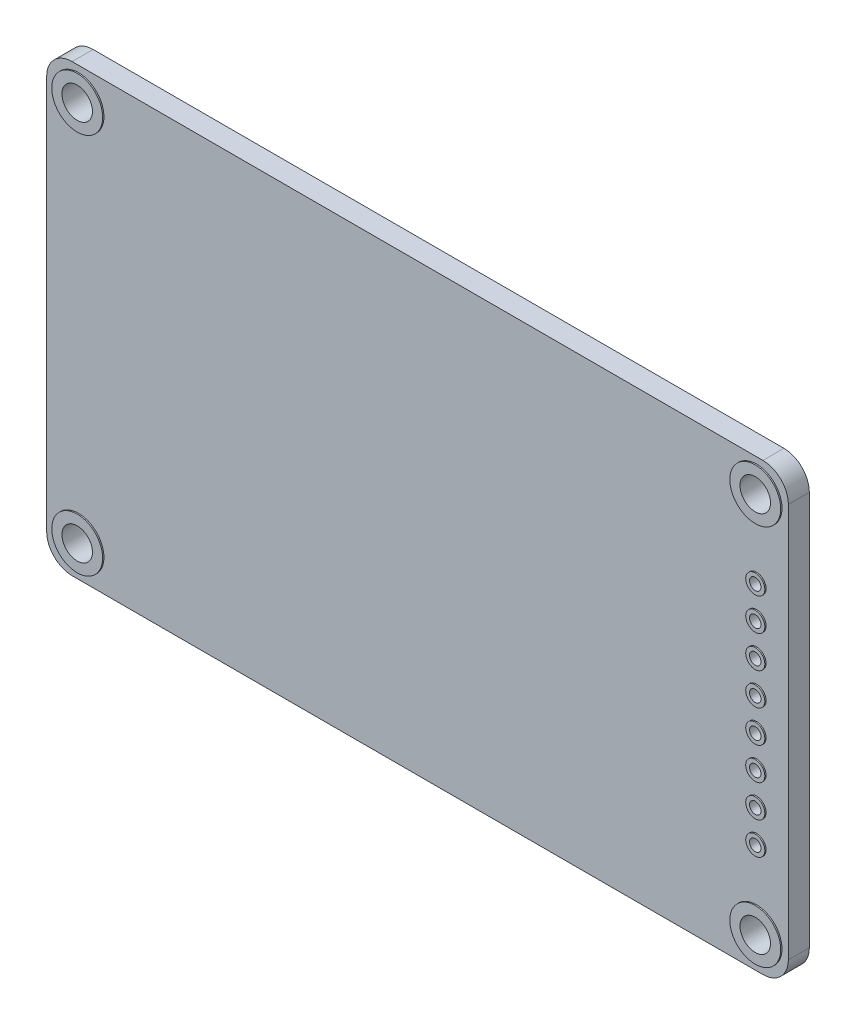
from build123d import *
from build123d.topology import SkipClean

# Parameters (mm, degrees)
EXTRUDE_1_DEPTH       = 1.65
HOLE_WIZARD_M21_D     = 2.4
HOLE_WIZARD_M21_DEPTH = 10
HOLE_WIZARD_M21_TIP   = 0.721032743
SKETCH_5_R            = 0.45
CUT_EXTRUDE_1_DEPTH   = 35.039609281
EXTRUDE_2_DEPTH       = 0.1
EXTRUDE_2_DEPTH_BACK  = 1.75
SKETCH_6_R            = 2
SKETCH_6_R_2          = 1.2
SKETCH_6_R_3          = 0.75
SKETCH_6_R_4          = 0.45
SKETCH_7_W            = 2.5
SKETCH_7_H            = 0.9
SKETCH_7_W_2          = 3.5
SKETCH_7_H_2          = 1.8
EXTRUDE_3_DEPTH       = 0.1


with BuildPart() as part:
    # Эскиз1 → Бобышка-Вытянуть1 (new body)
    with BuildSketch(Plane.XY):
        with BuildLine():
            Line((-27.15, -17.5), (27.15, -17.5))
            ThreePointArc((27.15, -17.5), (28.564213562, -16.914213562), (29.15, -15.5))
            Line((29.15, -15.5), (29.15, 15.5))
            ThreePointArc((29.15, 15.5), (28.564213562, 16.914213562), (27.15, 17.5))
            Line((27.15, 17.5), (-27.15, 17.5))
            ThreePointArc((-27.15, 17.5), (-28.564213562, 16.914213562), (-29.15, 15.5))
            Line((-29.15, 15.5), (-29.15, -15.5))
            ThreePointArc((-29.15, -15.5), (-28.564213562, -16.914213562), (-27.15, -17.5))
        make_face()
    extrude(amount=EXTRUDE_1_DEPTH)

    # Отверстие с зазором M21
    with Locations(Plane.XY.offset(1.65)):
        with Locations((26.65, 15), (-26.65, -15), (-26.65, 15), (26.65, -15)):
            Hole(HOLE_WIZARD_M21_D / 2, depth=HOLE_WIZARD_M21_DEPTH)
            with Locations((0, 0, -(HOLE_WIZARD_M21_DEPTH + HOLE_WIZARD_M21_TIP / 2))):  # 118° drill point
                Cone(0, HOLE_WIZARD_M21_D / 2, HOLE_WIZARD_M21_TIP, mode=Mode.SUBTRACT)

    # Эскиз5 → Вырез-Вытянуть1 (cut, through all)
    with BuildSketch(Plane.XY.offset(1.65)):
        with Locations((26.65, -8.89)):
            Circle(SKETCH_5_R)
        with Locations((26.65, -6.35)):
            Circle(SKETCH_5_R)
        with Locations((26.65, -3.81)):
            Circle(SKETCH_5_R)
        with Locations((26.65, -1.27)):
            Circle(SKETCH_5_R)
        with Locations((26.65, 1.27)):
            Circle(SKETCH_5_R)
        with Locations((26.65, 3.81)):
            Circle(SKETCH_5_R)
        with Locations((26.65, 6.35)):
            Circle(SKETCH_5_R)
        with Locations((26.65, 8.89)):
            Circle(SKETCH_5_R)
    extrude(amount=-CUT_EXTRUDE_1_DEPTH, mode=Mode.SUBTRACT)

    # Эскиз6 → Бобышка-Вытянуть2 (add, two sides: drawn at the far end of the back side and taken through both)
    # profile 1 of 12: a face of its own
    with SkipClean():  # the faces are left unmerged after this step: merging them gives an invalid solid
        with BuildSketch(Plane.XY.offset(1.65).offset(-EXTRUDE_2_DEPTH_BACK)):
            with Locations(Location((-26.65, 15, 0), (0, 0, 180))):
                Circle(SKETCH_6_R)
            with Locations((-26.65, 15)):
                Circle(SKETCH_6_R_2, mode=Mode.SUBTRACT)
        # profile 2 of 12: a face of its own
        with BuildSketch(Plane.XY.offset(1.65).offset(-EXTRUDE_2_DEPTH_BACK)):
            with Locations(Location((26.65, 15, 0), (0, 0, 180))):
                Circle(SKETCH_6_R)
            with Locations((26.65, 15)):
                Circle(SKETCH_6_R_2, mode=Mode.SUBTRACT)
        # profile 3 of 12: a face of its own
        with BuildSketch(Plane.XY.offset(1.65).offset(-EXTRUDE_2_DEPTH_BACK)):
            with Locations(Location((26.65, -15, 0), (0, 0, 180))):
                Circle(SKETCH_6_R)
            with Locations((26.65, -15)):
                Circle(SKETCH_6_R_2, mode=Mode.SUBTRACT)
        # profile 4 of 12: a face of its own
        with BuildSketch(Plane.XY.offset(1.65).offset(-EXTRUDE_2_DEPTH_BACK)):
            with Locations(Location((-26.65, -15, 0), (0, 0, 180))):
                Circle(SKETCH_6_R)
            with Locations((-26.65, -15)):
                Circle(SKETCH_6_R_2, mode=Mode.SUBTRACT)
        # profile 5 of 12: a face of its own
        with BuildSketch(Plane.XY.offset(1.65).offset(-EXTRUDE_2_DEPTH_BACK)):
            with Locations(Location((26.65, -8.89, 0), (0, 0, 180))):
                Circle(SKETCH_6_R_3)
            with Locations((26.65, -8.89)):
                Circle(SKETCH_6_R_4, mode=Mode.SUBTRACT)
        # profile 6 of 12: a face of its own
        with BuildSketch(Plane.XY.offset(1.65).offset(-EXTRUDE_2_DEPTH_BACK)):
            with Locations(Location((26.65, -6.35, 0), (0, 0, 180))):
                Circle(SKETCH_6_R_3)
            with Locations((26.65, -6.35)):
                Circle(SKETCH_6_R_4, mode=Mode.SUBTRACT)
        # profile 7 of 12: a face of its own
        with BuildSketch(Plane.XY.offset(1.65).offset(-EXTRUDE_2_DEPTH_BACK)):
            with Locations(Location((26.65, -3.81, 0), (0, 0, 180))):
                Circle(SKETCH_6_R_3)
            with Locations((26.65, -3.81)):
                Circle(SKETCH_6_R_4, mode=Mode.SUBTRACT)
        # profile 8 of 12: a face of its own
        with BuildSketch(Plane.XY.offset(1.65).offset(-EXTRUDE_2_DEPTH_BACK)):
            with Locations(Location((26.65, -1.27, 0), (0, 0, 180))):
                Circle(SKETCH_6_R_3)
            with Locations((26.65, -1.27)):
                Circle(SKETCH_6_R_4, mode=Mode.SUBTRACT)
        # profile 9 of 12: a face of its own
        with BuildSketch(Plane.XY.offset(1.65).offset(-EXTRUDE_2_DEPTH_BACK)):
            with Locations(Location((26.65, 1.27, 0), (0, 0, 180))):
                Circle(SKETCH_6_R_3)
            with Locations((26.65, 1.27)):
                Circle(SKETCH_6_R_4, mode=Mode.SUBTRACT)
        # profile 10 of 12: a face of its own
        with BuildSketch(Plane.XY.offset(1.65).offset(-EXTRUDE_2_DEPTH_BACK)):
            with Locations(Location((26.65, 3.81, 0), (0, 0, 180))):
                Circle(SKETCH_6_R_3)
            with Locations((26.65, 3.81)):
                Circle(SKETCH_6_R_4, mode=Mode.SUBTRACT)
        # profile 11 of 12: a face of its own
        with BuildSketch(Plane.XY.offset(1.65).offset(-EXTRUDE_2_DEPTH_BACK)):
            with Locations(Location((26.65, 6.35, 0), (0, 0, 180))):
                Circle(SKETCH_6_R_3)
            with Locations((26.65, 6.35)):
                Circle(SKETCH_6_R_4, mode=Mode.SUBTRACT)
        # profile 12 of 12: a face of its own
        with BuildSketch(Plane.XY.offset(1.65).offset(-EXTRUDE_2_DEPTH_BACK)):
            with Locations(Location((26.65, 8.89, 0), (0, 0, 180))):
                Circle(SKETCH_6_R_3)
            with Locations((26.65, 8.89)):
                Circle(SKETCH_6_R_4, mode=Mode.SUBTRACT)
        extrude(amount=EXTRUDE_2_DEPTH + EXTRUDE_2_DEPTH_BACK)
    add(part.part.scale(1), mode=Mode.REPLACE)  # the faces are merged on a copy

    # Эскиз7 → Бобышка-Вытянуть3 (add)
    with BuildSketch(Plane(origin=(0, 0, 0), x_dir=(-1, 0, 0), z_dir=(0, 0, -1))):
        with Locations((17.2, -5)):
            Rectangle(SKETCH_7_W, SKETCH_7_H)
        with Locations((17.2, -7)):
            Rectangle(SKETCH_7_W, SKETCH_7_H)
        with Locations((17.2, -3)):
            Rectangle(SKETCH_7_W, SKETCH_7_H)
        with Locations((17.2, -1)):
            Rectangle(SKETCH_7_W, SKETCH_7_H)
        with Locations((17.2, 1)):
            Rectangle(SKETCH_7_W, SKETCH_7_H)
        with Locations((17.2, 3)):
            Rectangle(SKETCH_7_W, SKETCH_7_H)
        with Locations((17.2, 5)):
            Rectangle(SKETCH_7_W, SKETCH_7_H)
        with Locations((17.2, 7)):
            Rectangle(SKETCH_7_W, SKETCH_7_H)
        with Locations((23.2, -9.65)):
            Rectangle(SKETCH_7_W_2, SKETCH_7_H_2)
        with Locations((23.2, 9.65)):
            Rectangle(SKETCH_7_W_2, SKETCH_7_H_2)
    extrude(amount=EXTRUDE_3_DEPTH)


solid = part.part
